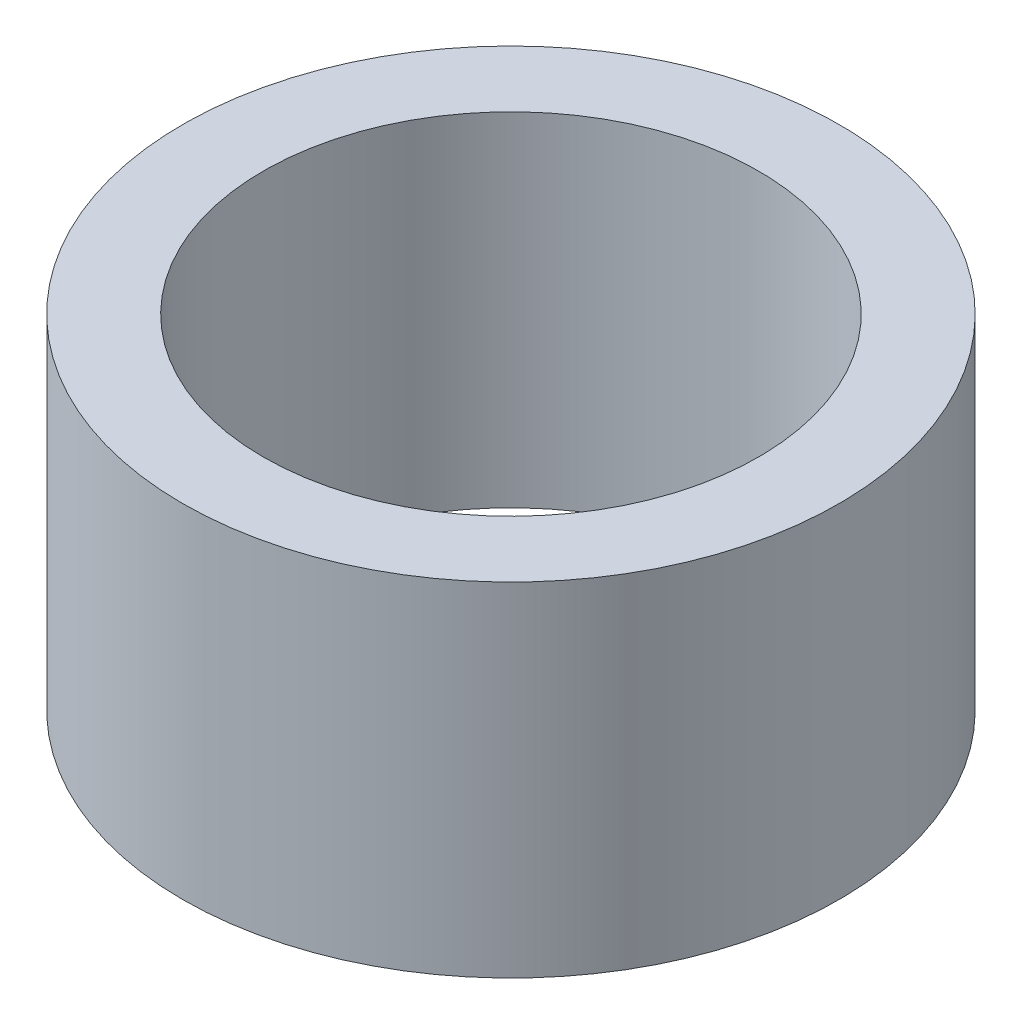
from build123d import *

# Parameters (mm, degrees)
SKETCH1_R           = 35
BOSS_EXTRUDE1_DEPTH = 36.564980309
SKETCH2_R           = 26.408507234
CUT_EXTRUDE1_DEPTH  = 62.538587772


with BuildPart() as part:
    # Sketch1 → Boss-Extrude1 (new body)
    with BuildSketch(Plane(origin=(0, 0, 0), x_dir=(1, 0, 0), z_dir=(0, 1, 0))):
        Circle(SKETCH1_R)
    extrude(amount=BOSS_EXTRUDE1_DEPTH)

    # Sketch2 → Cut-Extrude1 (cut, through all)
    with BuildSketch(Plane(origin=(0, 0, 0), x_dir=(1, 0, 0), z_dir=(0, 1, 0))):
        Circle(SKETCH2_R)
    extrude(amount=CUT_EXTRUDE1_DEPTH, mode=Mode.SUBTRACT)


solid = part.part
